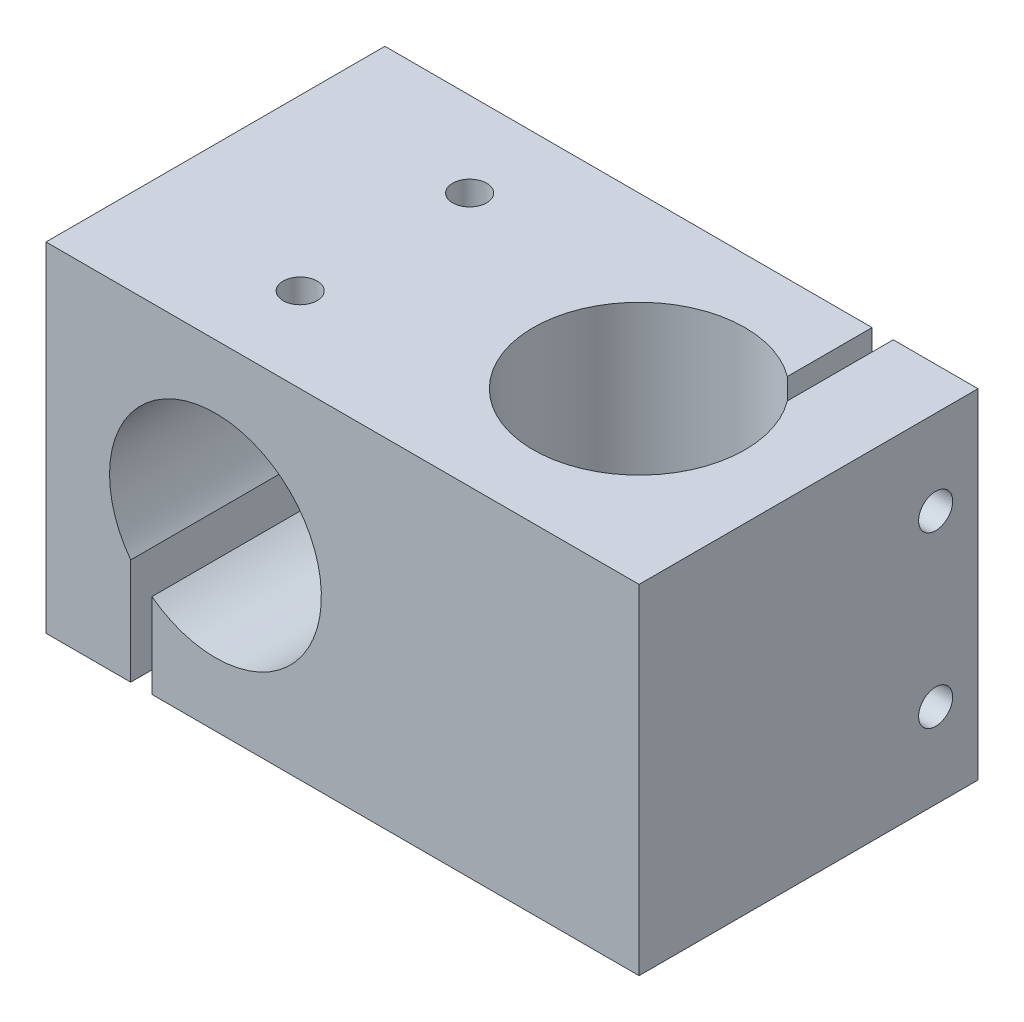
from build123d import *

# Parameters (mm, degrees)
SKETCH1_W                   = 88.9
SKETCH1_H                   = 50.8
BOSS_EXTRUDE1_DEPTH         = 25.4
CUT_EXTRUDE1_REACH          = 74.122
SKETCH2_R                   = 15.875
SKETCH3_W                   = 3.175
SKETCH3_H                   = 15.875
CUT_EXTRUDE4_DEPTH          = 50.8
F_1_4_20_TAPPED_HOLE1_D     = 5.1054
F_1_4_20_TAPPED_HOLE1_DEPTH = 25.4
F_1_4_20_TAPPED_HOLE1_TIP   = 1.533816902
SKETCH7_R                   = 15.875
CUT_EXTRUDE5_DEPTH          = 50.8
SKETCH8_W                   = 3.175
SKETCH8_H                   = 15.875
CUT_EXTRUDE6_DEPTH          = 50.8
F_1_4_20_TAPPED_HOLE2_D     = 5.1054
F_1_4_20_TAPPED_HOLE2_DEPTH = 25.4
F_1_4_20_TAPPED_HOLE2_TIP   = 1.533816902
F_1_4_20_TAPPED_HOLE3_D     = 5.1054
F_1_4_20_TAPPED_HOLE3_DEPTH = 25.4
F_1_4_20_TAPPED_HOLE3_TIP   = 1.533816902


with BuildPart() as part:
    # Sketch1 → Boss-Extrude1 (new, symmetric)
    with BuildSketch(Plane(origin=(0, 0, 0), x_dir=(1, 0, 0), z_dir=(0, 1, 0))):
        Rectangle(SKETCH1_W, SKETCH1_H)
    extrude(amount=BOSS_EXTRUDE1_DEPTH, both=True)

    # Sketch2 → Cut-Extrude1 (cut, up to next)
    with BuildSketch(Plane(origin=(0, 25.4, 0), x_dir=(1, 0, 0), z_dir=(0, 1, 0)), mode=Mode.PRIVATE) as cut_extrude1_sk1:
        with Locations((19.05, 0)):
            Circle(SKETCH2_R)
    cut_extrude1_tool1 = extrude(cut_extrude1_sk1.sketch, amount=-CUT_EXTRUDE1_REACH, mode=Mode.PRIVATE) & part.part
    add(cut_extrude1_tool1.solids().sort_by_distance((19.05, 25.4, 0))[0], mode=Mode.SUBTRACT)

    # Sketch3 → Cut-Extrude4 (cut)
    with BuildSketch(Plane(origin=(0, 25.4, 0), x_dir=(1, 0, 0), z_dir=(0, 1, 0))):
        with Locations((30.1625, 17.4625)):
            Rectangle(SKETCH3_W, SKETCH3_H)
    extrude(amount=-CUT_EXTRUDE4_DEPTH, mode=Mode.SUBTRACT)

    # 1/4-20 Tapped Hole1
    with Locations(Plane(origin=(44.45, 0, 0), x_dir=(0, 0, -1), z_dir=(1, 0, 0))):
        with Locations((19.05, 12.7), (19.05, -12.7)):
            Hole(F_1_4_20_TAPPED_HOLE1_D / 2, depth=F_1_4_20_TAPPED_HOLE1_DEPTH)
            with Locations((0, 0, -(F_1_4_20_TAPPED_HOLE1_DEPTH + F_1_4_20_TAPPED_HOLE1_TIP / 2))):  # 118° drill point
                Cone(0, F_1_4_20_TAPPED_HOLE1_D / 2, F_1_4_20_TAPPED_HOLE1_TIP, mode=Mode.SUBTRACT)

    # Sketch7 → Cut-Extrude5 (cut)
    with BuildSketch(Plane.XY.offset(25.4)):
        with Locations((-19.05, 0)):
            Circle(SKETCH7_R)
    extrude(amount=-CUT_EXTRUDE5_DEPTH, mode=Mode.SUBTRACT)

    # Sketch8 → Cut-Extrude6 (cut)
    with BuildSketch(Plane.XY.offset(25.4)):
        with Locations((-30.1625, -17.4625)):
            Rectangle(SKETCH8_W, SKETCH8_H)
    extrude(amount=-CUT_EXTRUDE6_DEPTH, mode=Mode.SUBTRACT)

    # 1/4-20 Tapped Hole2
    with Locations(Plane.ZY.offset(44.45)):
        with Locations((-12.7, -19.05), (12.7, -19.05)):
            Hole(F_1_4_20_TAPPED_HOLE2_D / 2, depth=F_1_4_20_TAPPED_HOLE2_DEPTH)
            with Locations((0, 0, -(F_1_4_20_TAPPED_HOLE2_DEPTH + F_1_4_20_TAPPED_HOLE2_TIP / 2))):  # 118° drill point
                Cone(0, F_1_4_20_TAPPED_HOLE2_D / 2, F_1_4_20_TAPPED_HOLE2_TIP, mode=Mode.SUBTRACT)

    # 1/4-20 Tapped Hole3
    with Locations(Plane(origin=(-19.05, 25.4, -12.7), x_dir=(0, 0, 1), z_dir=(0, 1, 0))):
        with Locations((0, 0), (25.4, 0)):
            Hole(F_1_4_20_TAPPED_HOLE3_D / 2, depth=F_1_4_20_TAPPED_HOLE3_DEPTH)
            with Locations((0, 0, -(F_1_4_20_TAPPED_HOLE3_DEPTH + F_1_4_20_TAPPED_HOLE3_TIP / 2))):  # 118° drill point
                Cone(0, F_1_4_20_TAPPED_HOLE3_D / 2, F_1_4_20_TAPPED_HOLE3_TIP, mode=Mode.SUBTRACT)


solid = part.part
